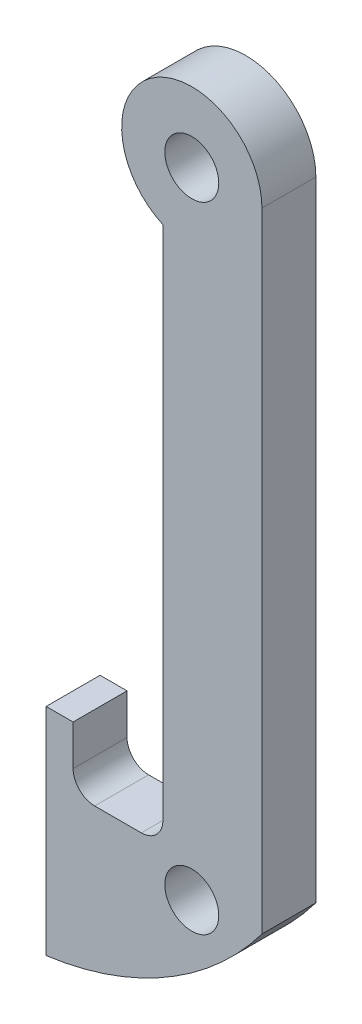
from build123d import *

# Parameters (mm, degrees)
SKETCH1_R           = 3.175
BOSS_EXTRUDE1_DEPTH = 3.175


with BuildPart() as part:
    # Sketch1 → Boss-Extrude1 (new, symmetric)
    with BuildSketch(Plane.XY):
        with BuildLine():
            Line((8.255, 0), (8.255, -74.000185382))
            ThreePointArc((8.255, -74.000185382), (-2.947305145, -84.00324186), (-17.145, -88.9))
            Line((-17.145, -88.9), (-17.145, -63.5))
            Line((-17.145, -63.5), (-13.97, -63.5))
            Line((-13.97, -63.5), (-13.97, -68.249071966))
            ThreePointArc((-13.97, -68.249071966), (-13.226051224, -70.04512319), (-11.43, -70.789071966))
            Line((-11.43, -70.789071966), (-5.941504606, -70.789071966))
            ThreePointArc((-5.941504606, -70.789071966), (-4.145453382, -70.04512319), (-3.401504606, -68.249071966))
            Line((-3.401504606, -68.249071966), (-3.401504606, -7.521621595))
            ThreePointArc((-3.401504606, -7.521621595), (-4.475801854, 6.936297482), (8.255, 0))
        make_face()
        Circle(SKETCH1_R, mode=Mode.SUBTRACT)
        with Locations((0, -74.668015763)):
            Circle(SKETCH1_R, mode=Mode.SUBTRACT)
    extrude(amount=BOSS_EXTRUDE1_DEPTH, both=True)


solid = part.part
